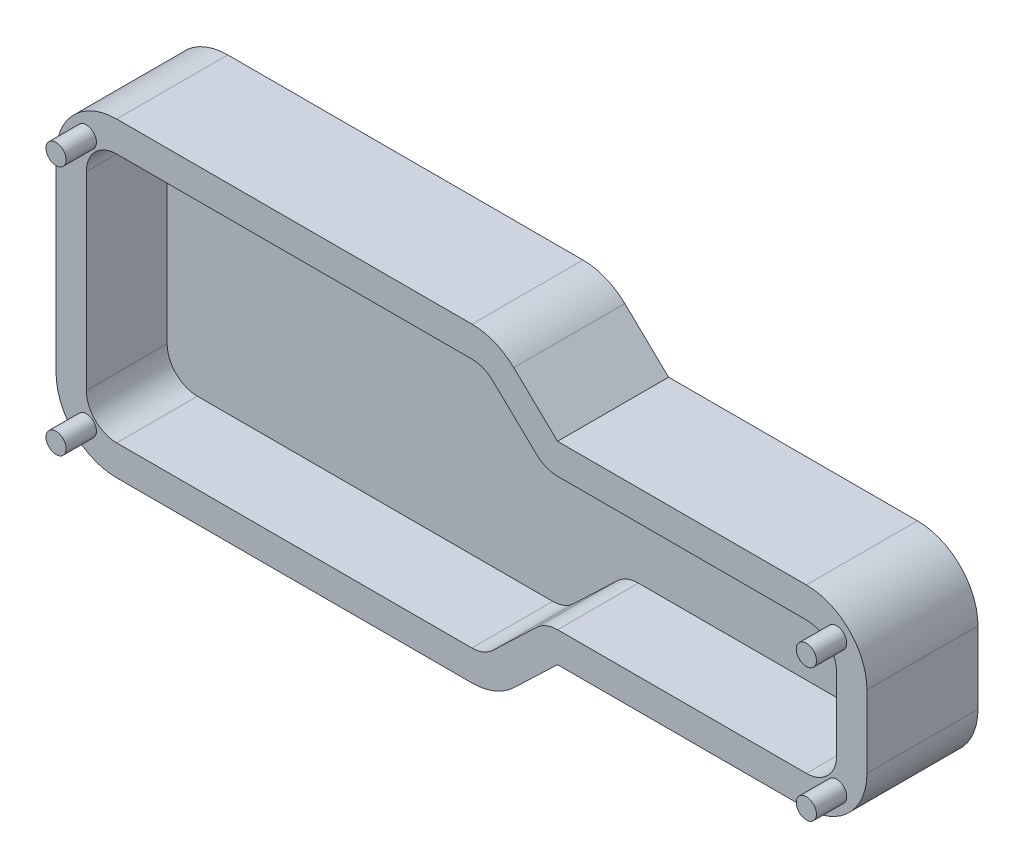
from build123d import *

# Parameters (mm, degrees)
BOSS_EXTRUDE2_DEPTH      = 8
BOSS_EXTRUDE2_DEPTH_BACK = 3
SKETCH3_R                = 1
BOSS_EXTRUDE3_DEPTH      = 3
BOSS_EXTRUDE4_DEPTH      = 3
BOSS_EXTRUDE4_DEPTH_BACK = 11
SKETCH7_R                = 1


with BuildPart() as part:
    # Sketch3 → Boss-Extrude2 (new, two sides: drawn at the far end of the back side and taken through both)
    with BuildSketch(Plane.XY.offset(-BOSS_EXTRUDE2_DEPTH_BACK)):
        with BuildLine():
            Line((-69.81, 20.47), (-34.625063383, 20.47))
            ThreePointArc((-34.625063383, 20.47), (-32.391172348, 20.03863815), (-30.478486436, 18.806576947))
            Line((-30.478486436, 18.806576947), (-26.141909489, 14.66))
            Line((-26.141909489, 14.66), (-1.5, 14.66))
            ThreePointArc((-1.5, 14.66), (2.742640687, 12.902640687), (4.5, 8.66))
            Line((4.5, 8.66), (4.5, 1.5))
            ThreePointArc((4.5, 1.5), (2.742640687, -2.742640687), (-1.5, -4.5))
            Line((-1.5, -4.5), (-26.141909489, -4.5))
            Line((-26.141909489, -4.5), (-30.478486436, -8.646576947))
            ThreePointArc((-30.478486436, -8.646576947), (-32.391172348, -9.87863815), (-34.625063383, -10.31))
            Line((-34.625063383, -10.31), (-69.81, -10.31))
            ThreePointArc((-69.81, -10.31), (-74.052640687, -8.552640687), (-75.81, -4.31))
            Line((-75.81, -4.31), (-75.81, 14.47))
            ThreePointArc((-75.81, 14.47), (-74.052640687, 18.712640687), (-69.81, 20.47))
        make_face()
        with Locations((-72.81, 17.47)):
            Circle(SKETCH3_R, mode=Mode.SUBTRACT)
        with Locations((-72.81, -7.31)):
            Circle(SKETCH3_R, mode=Mode.SUBTRACT)
        with Locations((1.5, -1.5)):
            Circle(SKETCH3_R, mode=Mode.SUBTRACT)
        with Locations((1.5, 11.66)):
            Circle(SKETCH3_R, mode=Mode.SUBTRACT)
        with BuildLine():
            Line((-69.81, 17.47), (-34.625063383, 17.47))
            ThreePointArc((-34.625063383, 17.47), (-33.508117866, 17.254319075), (-32.55177491, 16.638288474))
            Line((-32.55177491, 16.638288474), (-28.215197962, 12.491711526))
            ThreePointArc((-28.215197962, 12.491711526), (-27.258855006, 11.875680925), (-26.141909489, 11.66))
            Line((-26.141909489, 11.66), (-1.5, 11.66))
            ThreePointArc((-1.5, 11.66), (0.621320344, 10.781320344), (1.5, 8.66))
            Line((1.5, 8.66), (1.5, 1.5))
            ThreePointArc((1.5, 1.5), (0.621320344, -0.621320344), (-1.5, -1.5))
            Line((-1.5, -1.5), (-26.141909489, -1.5))
            ThreePointArc((-26.141909489, -1.5), (-27.258855006, -1.715680925), (-28.215197962, -2.331711526))
            Line((-28.215197962, -2.331711526), (-32.55177491, -6.478288474))
            ThreePointArc((-32.55177491, -6.478288474), (-33.508117866, -7.094319075), (-34.625063383, -7.31))
            Line((-34.625063383, -7.31), (-69.81, -7.31))
            ThreePointArc((-69.81, -7.31), (-71.931320344, -6.431320344), (-72.81, -4.31))
            Line((-72.81, -4.31), (-72.81, 14.47))
            ThreePointArc((-72.81, 14.47), (-71.931320344, 16.591320344), (-69.81, 17.47))
        make_face(mode=Mode.SUBTRACT)
    extrude(amount=BOSS_EXTRUDE2_DEPTH + BOSS_EXTRUDE2_DEPTH_BACK)

    # Sketch5 → Boss-Extrude3 (add)
    with BuildSketch(Plane(origin=(0, 0, -3), x_dir=(-1, 0, 0), z_dir=(0, 0, -1))):
        with BuildLine():
            Line((-1.5, 8.66), (-1.5, 1.5))
            ThreePointArc((-1.5, 1.5), (-0.621320344, -0.621320344), (1.5, -1.5))
            Line((1.5, -1.5), (26.141909489, -1.5))
            ThreePointArc((26.141909489, -1.5), (27.258855006, -1.715680925), (28.215197962, -2.331711526))
            Line((28.215197962, -2.331711526), (32.55177491, -6.478288474))
            ThreePointArc((32.55177491, -6.478288474), (33.508117866, -7.094319075), (34.625063383, -7.31))
            Line((34.625063383, -7.31), (69.81, -7.31))
            ThreePointArc((69.81, -7.31), (71.931320344, -6.431320344), (72.81, -4.31))
            Line((72.81, -4.31), (72.81, 14.47))
            ThreePointArc((72.81, 14.47), (71.931320344, 16.591320344), (69.81, 17.47))
            Line((69.81, 17.47), (34.625063383, 17.47))
            ThreePointArc((34.625063383, 17.47), (33.508117866, 17.254319075), (32.55177491, 16.638288474))
            Line((32.55177491, 16.638288474), (28.215197962, 12.491711526))
            ThreePointArc((28.215197962, 12.491711526), (27.258855006, 11.875680925), (26.141909489, 11.66))
            Line((26.141909489, 11.66), (1.5, 11.66))
            ThreePointArc((1.5, 11.66), (-0.621320344, 10.781320344), (-1.5, 8.66))
        make_face()
    extrude(amount=-BOSS_EXTRUDE3_DEPTH)

    # Sketch7 → Boss-Extrude4 (add, two sides: drawn at the far end of the back side and taken through both)
    with BuildSketch(Plane.XY.offset(8).offset(-BOSS_EXTRUDE4_DEPTH_BACK)):
        with Locations((-72.81, 17.47)):
            Circle(SKETCH7_R)
        with Locations((1.5, -1.5)):
            Circle(SKETCH7_R)
        with Locations((1.5, 11.66)):
            Circle(SKETCH7_R)
        with Locations((-72.81, -7.31)):
            Circle(SKETCH7_R)
    extrude(amount=BOSS_EXTRUDE4_DEPTH + BOSS_EXTRUDE4_DEPTH_BACK)


solid = part.part
